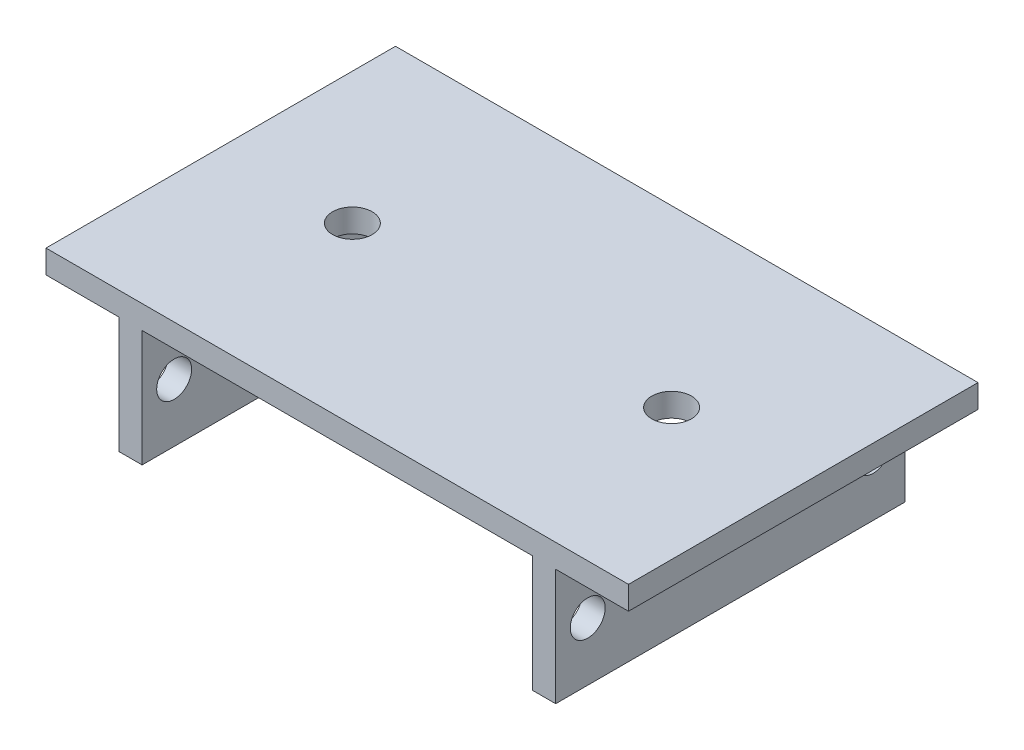
from build123d import *

# Parameters (mm, degrees)
SKETCH1_W                                 = 50
SKETCH1_H                                 = 30
BOSS_EXTRUDE1_DEPTH                       = 2
SKETCH6_W                                 = 2
SKETCH6_H                                 = 30
BOSS_EXTRUDE2_DEPTH                       = 10
M3X0_5_TAPPED_HOLE1_D                     = 2.5
M3X0_5_TAPPED_HOLE1_DEPTH                 = 10
M3X0_5_TAPPED_HOLE1_CBORE_D               = 3
M3X0_5_TAPPED_HOLE1_CBORE_DEPTH           = 6
M3X0_5_TAPPED_HOLE1_TIP                   = 0.751075774
M3X0_5_TAPPED_HOLE1_ON_FACE_2_D           = 2.5
M3X0_5_TAPPED_HOLE1_ON_FACE_2_DEPTH       = 10
M3X0_5_TAPPED_HOLE1_ON_FACE_2_CBORE_D     = 3
M3X0_5_TAPPED_HOLE1_ON_FACE_2_CBORE_DEPTH = 6
M3X0_5_TAPPED_HOLE1_ON_FACE_2_TIP         = 0.751075774
M3_CLEARANCE_HOLE4_D                      = 3.4


with BuildPart() as part:
    # Sketch1 → Boss-Extrude1 (new body)
    with BuildSketch(Plane(origin=(0, 0, 0), x_dir=(1, 0, 0), z_dir=(0, 1, 0))):
        with Locations((-47.186085356, 15.4944519)):
            Rectangle(SKETCH1_W, SKETCH1_H)
    extrude(amount=BOSS_EXTRUDE1_DEPTH)

    # Sketch6 → Boss-Extrude2 (add)
    with BuildSketch(Plane(origin=(0, 0, 0), x_dir=(1, 0, 0), z_dir=(0, 1, 0))):
        with Locations((-64.936085356, 15.4944519)):
            Rectangle(SKETCH6_W, SKETCH6_H)
        with Locations((-29.436085356, 15.4944519)):
            Rectangle(SKETCH6_W, SKETCH6_H)
    extrude(amount=-BOSS_EXTRUDE2_DEPTH)

    # M3x0.5 Tapped Hole1
    with Locations(Plane(origin=(-65.936085356, -5, -27.7444519), x_dir=(0, 0, -1), z_dir=(-1, 0, 0))):
        with Locations((0, 0), (-24.5, 0)):
            CounterBoreHole(M3X0_5_TAPPED_HOLE1_D / 2, M3X0_5_TAPPED_HOLE1_CBORE_D / 2, M3X0_5_TAPPED_HOLE1_CBORE_DEPTH, depth=M3X0_5_TAPPED_HOLE1_DEPTH)
            with Locations((0, 0, -(M3X0_5_TAPPED_HOLE1_DEPTH + M3X0_5_TAPPED_HOLE1_TIP / 2))):  # 118° drill point
                Cone(0, M3X0_5_TAPPED_HOLE1_D / 2, M3X0_5_TAPPED_HOLE1_TIP, mode=Mode.SUBTRACT)

    # M3x0.5 Tapped Hole1 on face 2
    with Locations(Plane(origin=(-28.436085356, -5, -27.7444519), x_dir=(0, 0, 1), z_dir=(1, 0, 0))):
        with Locations((0, 0), (24.5, 0)):
            CounterBoreHole(M3X0_5_TAPPED_HOLE1_ON_FACE_2_D / 2, M3X0_5_TAPPED_HOLE1_ON_FACE_2_CBORE_D / 2, M3X0_5_TAPPED_HOLE1_ON_FACE_2_CBORE_DEPTH, depth=M3X0_5_TAPPED_HOLE1_ON_FACE_2_DEPTH)
            with Locations((0, 0, -(M3X0_5_TAPPED_HOLE1_ON_FACE_2_DEPTH + M3X0_5_TAPPED_HOLE1_ON_FACE_2_TIP / 2))):  # 118° drill point
                Cone(0, M3X0_5_TAPPED_HOLE1_ON_FACE_2_D / 2, M3X0_5_TAPPED_HOLE1_ON_FACE_2_TIP, mode=Mode.SUBTRACT)

    # M3 Clearance Hole4 (through all)
    with Locations(Plane(origin=(0, 0, 0), x_dir=(-1, 0, 0), z_dir=(0, -1, 0))):
        with Locations((33.486085356, 15.4944519), (60.886085356, 15.4944519)):
            Hole(M3_CLEARANCE_HOLE4_D / 2)


solid = part.part
